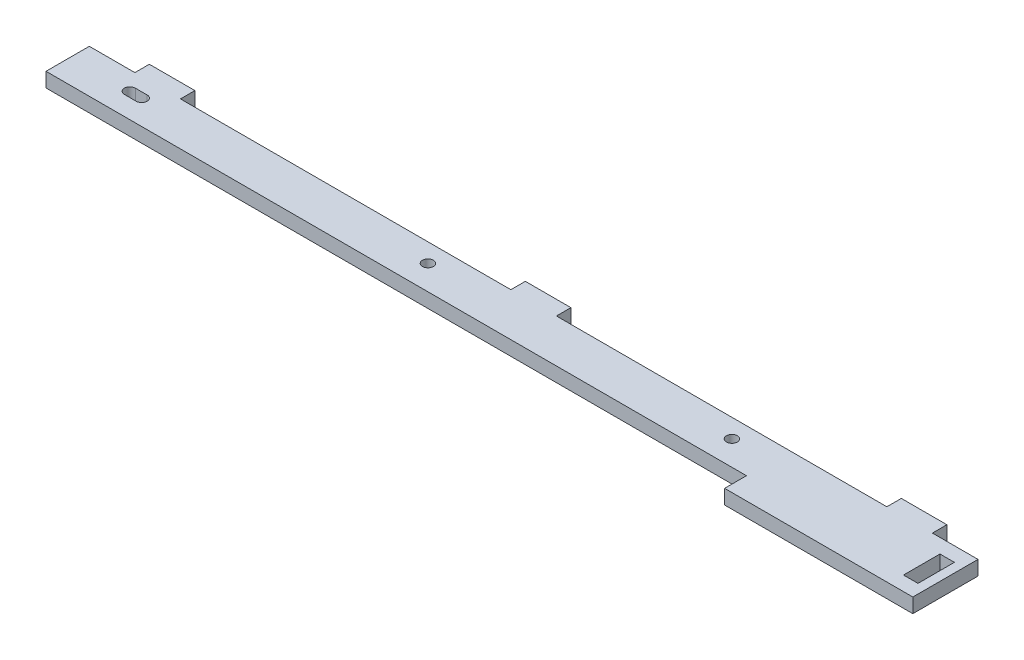
from build123d import *

# Parameters (mm, degrees)
SKETCH1_W                = 195
SKETCH1_H                = 9.5
BOSS_EXTRUDE1_DEPTH      = 3.175
M2_CLEARANCE_HOLE1_D     = 2.4
SKETCH5_W                = 10
SKETCH5_H                = 3.175
BOSS_EXTRUDE2_DEPTH      = 3.175
SKETCH6_W                = 41.3
SKETCH6_H                = 3.175
BOSS_EXTRUDE3_DEPTH      = 4.8
SKETCH7_W                = 3.175
SKETCH7_H                = 8
CUT_EXTRUDE1_DEPTH       = 99.01802449
M2_CLEARANCE_SLOT1_DEPTH = 3.175


# Read off the part's stored shape, not the designer's step: M2 Clearance Slot1
with BuildPart() as part:
    # Sketch1 → Boss-Extrude1 (new body)
    with BuildSketch(Plane(origin=(0, 0, 0), x_dir=(1, 0, 0), z_dir=(0, 1, 0))):
        Rectangle(SKETCH1_W, SKETCH1_H)
    extrude(amount=BOSS_EXTRUDE1_DEPTH)

    # M2 Clearance Hole1 (through all)
    with Locations(Plane(origin=(0, 3.175, 0), x_dir=(1, 0, 0), z_dir=(0, 1, 0))):
        with Locations((-83.2, 0.65), (47.6, 0.65), (-19.1, 0.65)):
            Hole(M2_CLEARANCE_HOLE1_D / 2)

    # Sketch5 → Boss-Extrude2 (add)
    with BuildSketch(Plane(origin=(0, 0, -4.75), x_dir=(-1, 0, 0), z_dir=(0, 0, -1))):
        with Locations((82.5, 1.5875)):
            Rectangle(SKETCH5_W, SKETCH5_H)
        with Locations((-82.5, 1.5875)):
            Rectangle(SKETCH5_W, SKETCH5_H)
        with Locations((0, 1.5875)):
            Rectangle(SKETCH5_W, SKETCH5_H)
    extrude(amount=BOSS_EXTRUDE2_DEPTH)

    # Sketch6 → Boss-Extrude3 (add)
    with BuildSketch(Plane.XY.offset(4.75)):
        with Locations((76.85, 1.5875)):
            Rectangle(SKETCH6_W, SKETCH6_H)
    extrude(amount=BOSS_EXTRUDE3_DEPTH)

    # Sketch7 → Cut-Extrude1 (cut, through all)
    with BuildSketch(Plane.XZ):
        with Locations((93.8875, 2.4)):
            Rectangle(SKETCH7_W, SKETCH7_H)
    extrude(amount=-CUT_EXTRUDE1_DEPTH, mode=Mode.SUBTRACT)

    # M2 Clearance Slot1 outline → M2 Clearance Slot1 (cut)
    with BuildSketch(Plane(origin=(0, 0, 0), x_dir=(1, 0, 0), z_dir=(0, 1, 0))):
        with BuildLine():
            ThreePointArc((-81.9, -0.55), (-80.7, 0.65), (-81.9, 1.85))
            Line((-81.9, 1.85), (-83.2, 1.85))
            ThreePointArc((-83.2, 1.85), (-82, 0.65), (-83.2, -0.55))
            Line((-83.2, -0.55), (-81.9, -0.55))
        make_face()
        with BuildLine():
            ThreePointArc((-83.2, -0.55), (-84.4, 0.65), (-83.2, 1.85))
            Line((-83.2, 1.85), (-84.5, 1.85))
            ThreePointArc((-84.5, 1.85), (-85.7, 0.65), (-84.5, -0.55))
            Line((-84.5, -0.55), (-83.2, -0.55))
        make_face()
    extrude(amount=M2_CLEARANCE_SLOT1_DEPTH, mode=Mode.SUBTRACT)


solid = part.part
